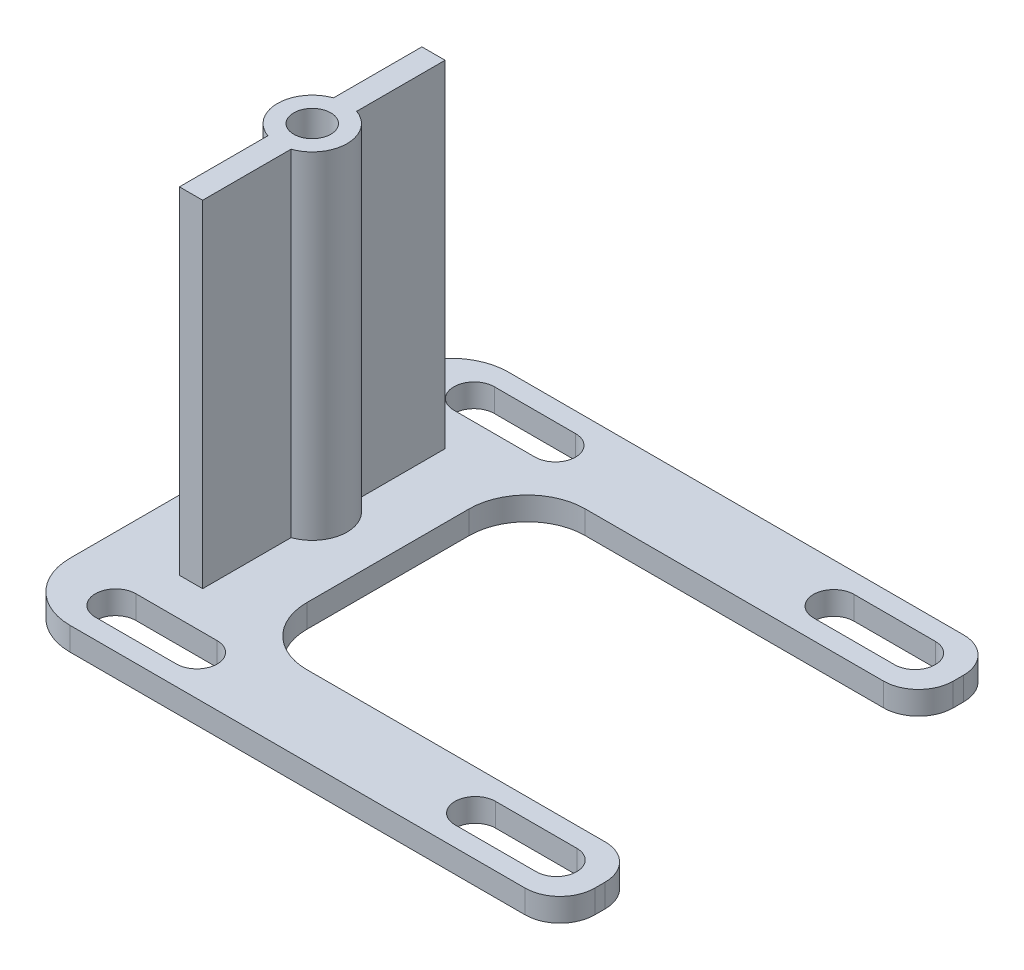
from build123d import *

# Parameters (mm, degrees)
BOSS_EXTRUDE1_DEPTH = 2
FILLET1_R           = 5
FILLET2_R           = 3
SKETCH2_R           = 1.6
BOSS_EXTRUDE2_DEPTH = 29


with BuildPart() as part:
    # Sketch1 → Boss-Extrude1 (new body)
    with BuildSketch(Plane(origin=(0, 0, 0), x_dir=(1, 0, 0), z_dir=(0, 1, 0))):
        Polygon((47.24332582, 30.9), (47.24332582, 37.8), (0, 37.8), (0, 0), (47.24332582, 0), (47.24332582, 6.9), (13.518849419, 6.9), (13.518849419, 30.9), align=None)
        with BuildLine():
            Line((5.49332582, 36.1), (12.49332582, 36.1))
            ThreePointArc((12.49332582, 36.1), (14.24332582, 34.35), (12.49332582, 32.6))
            Line((12.49332582, 32.6), (5.49332582, 32.6))
            ThreePointArc((5.49332582, 32.6), (3.74332582, 34.35), (5.49332582, 36.1))
        make_face(mode=Mode.SUBTRACT)
        with BuildLine():
            Line((36.49332582, 36.1), (43.49332582, 36.1))
            ThreePointArc((43.49332582, 36.1), (45.24332582, 34.35), (43.49332582, 32.6))
            Line((43.49332582, 32.6), (36.49332582, 32.6))
            ThreePointArc((36.49332582, 32.6), (34.74332582, 34.35), (36.49332582, 36.1))
        make_face(mode=Mode.SUBTRACT)
        with BuildLine():
            Line((5.49332582, 5.2), (12.49332582, 5.2))
            ThreePointArc((12.49332582, 5.2), (14.24332582, 3.45), (12.49332582, 1.7))
            Line((12.49332582, 1.7), (5.49332582, 1.7))
            ThreePointArc((5.49332582, 1.7), (3.74332582, 3.45), (5.49332582, 5.2))
        make_face(mode=Mode.SUBTRACT)
        with BuildLine():
            Line((36.49332582, 5.2), (43.49332582, 5.2))
            ThreePointArc((43.49332582, 5.2), (45.24332582, 3.45), (43.49332582, 1.7))
            Line((43.49332582, 1.7), (36.49332582, 1.7))
            ThreePointArc((36.49332582, 1.7), (34.74332582, 3.45), (36.49332582, 5.2))
        make_face(mode=Mode.SUBTRACT)
    extrude(amount=BOSS_EXTRUDE1_DEPTH)

    # Fillet1
    fillet1_edges = [part.edges().sort_by_distance(p)[0] for p in [
        (0, 1, -37.8),
        (0, 1, 0),
        (13.518849419, 1, -6.9),
        (13.518849419, 1, -30.9),
    ]]
    fillet(fillet1_edges, radius=FILLET1_R)

    # Fillet2
    fillet2_edges = [part.edges().sort_by_distance(p)[0] for p in [
        (47.24332582, 1, -6.9),
        (47.24332582, 1, 0),
        (47.24332582, 1, -30.9),
        (47.24332582, 1, -37.8),
    ]]
    fillet(fillet2_edges, radius=FILLET2_R)

    # Sketch2 → Boss-Extrude2 (add)
    with BuildSketch(Plane(origin=(0, 2, 0), x_dir=(1, 0, 0), z_dir=(0, 1, 0))):
        with BuildLine():
            Line((5.99332582, 21.728427125), (5.99332582, 29.35))
            Line((5.99332582, 29.35), (7.99332582, 29.35))
            Line((7.99332582, 29.35), (7.99332582, 21.728427125))
            ThreePointArc((7.99332582, 21.728427125), (9.99332582, 18.9), (7.99332582, 16.071572875))
            Line((7.99332582, 16.071572875), (7.99332582, 8.45))
            Line((7.99332582, 8.45), (5.99332582, 8.45))
            Line((5.99332582, 8.45), (5.99332582, 16.071572875))
            ThreePointArc((5.99332582, 16.071572875), (3.99332582, 18.9), (5.99332582, 21.728427125))
        make_face()
        with Locations((6.99332582, 18.9)):
            Circle(SKETCH2_R, mode=Mode.SUBTRACT)
    extrude(amount=BOSS_EXTRUDE2_DEPTH)


solid = part.part
